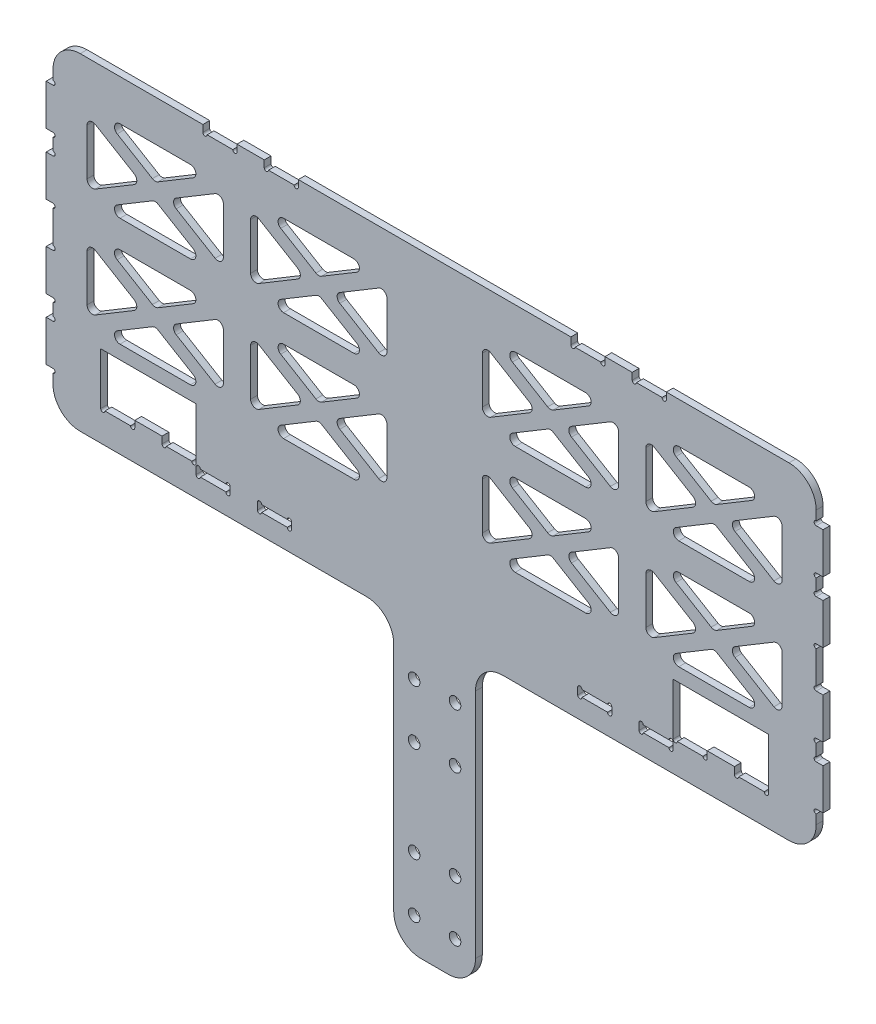
from build123d import *

# Parameters (mm, degrees)
EXTRUDE_1_DEPTH                = 5
SKETCH_2_R                     = 4.25
CUT_EXTRUDE_1_DEPTH            = 26
FILLET_1_R                     = 20
SKETCH_3_W                     = 5
SKETCH_3_H                     = 30
EXTRUDE_2_DEPTH                = 5
SKETCH_4_W                     = 70
SKETCH_4_H                     = 33
CUT_EXTRUDE_2_DEPTH            = 10
CUT_EXTRUDE_3_DEPTH            = 10
CUT_EXTRUDE_4_DEPTH            = 10
SKETCH_7_R                     = 1.55
CUT_EXTRUDE_5_DEPTH            = 5
CUT_EXTRUDE_6_DEPTH            = 5
FILLET_2_R                     = 4
PATTERN_LINEAR_1_COUNT         = 2
PATTERN_LINEAR_1_PITCH         = 120
PATTERN_LINEAR_1_COUNT_DIR2    = 2
PATTERN_LINEAR_1_PITCH_DIR2    = 80
FILLET_2_OF_PATTERN_LINEAR_1_R = 4
MIRROR_1_DEPTH                 = 5


# Read off the part's stored shape, not the designer's step: 镜向1
with BuildPart() as part:
    # 草图1 → 凸台-拉伸1 (new body)
    with BuildSketch(Plane.XY):
        Polygon((-30, 0), (30, 0), (30, 210), (280, 210), (280, 450), (-280, 450), (-280, 210), (-30, 210), align=None)
    extrude(amount=EXTRUDE_1_DEPTH)

    # 草图2 → 切除-拉伸1 (cut)
    with BuildSketch(Plane.XY.offset(5)):
        with Locations((15, 25)):
            Circle(SKETCH_2_R)
        with Locations((15, 65)):
            Circle(SKETCH_2_R)
        with Locations((15, 135)):
            Circle(SKETCH_2_R)
        with Locations((15, 175)):
            Circle(SKETCH_2_R)
        with Locations(Location((-15, 175, 0), (0, 0, 180))):
            Circle(SKETCH_2_R)
        with Locations(Location((-15, 135, 0), (0, 0, 180))):
            Circle(SKETCH_2_R)
        with Locations(Location((-15, 65, 0), (0, 0, 180))):
            Circle(SKETCH_2_R)
        with Locations(Location((-15, 25, 0), (0, 0, 180))):
            Circle(SKETCH_2_R)
    extrude(amount=-CUT_EXTRUDE_1_DEPTH, mode=Mode.SUBTRACT)

    # 圆角1
    fillet_1_edges = [part.edges().sort_by_distance(p)[0] for p in [
        (30, 0, 2.5),
        (-30, 0, 2.5),
        (-30, 210, 2.5),
        (-280, 210, 2.5),
        (-280, 450, 2.5),
        (280, 450, 2.5),
        (280, 210, 2.5),
        (30, 210, 2.5),
    ]]
    fillet(fillet_1_edges, radius=FILLET_1_R)

    # 草图3 → 凸台-拉伸2 (add)
    with BuildSketch(Plane.XY.offset(5)):
        with Locations((282.5, 255)):
            Rectangle(SKETCH_3_W, SKETCH_3_H)
        with Locations((282.5, 300)):
            Rectangle(SKETCH_3_W, SKETCH_3_H)
        with Locations((282.5, 405)):
            Rectangle(SKETCH_3_W, SKETCH_3_H)
        with Locations((282.5, 360)):
            Rectangle(SKETCH_3_W, SKETCH_3_H)
        with Locations((-282.5, 360)):
            Rectangle(SKETCH_3_W, SKETCH_3_H)
        with Locations((-282.5, 405)):
            Rectangle(SKETCH_3_W, SKETCH_3_H)
        with Locations((-282.5, 255)):
            Rectangle(SKETCH_3_W, SKETCH_3_H)
        with Locations((-282.5, 300)):
            Rectangle(SKETCH_3_W, SKETCH_3_H)
    extrude(amount=-EXTRUDE_2_DEPTH)

    # 草图4 → 切除-拉伸2 (cut)
    with BuildSketch(Plane.XY.offset(5)):
        with Locations((210, 253.5)):
            Rectangle(SKETCH_4_W, SKETCH_4_H)
        with Locations((-210, 253.5)):
            Rectangle(SKETCH_4_W, SKETCH_4_H)
    extrude(amount=-CUT_EXTRUDE_2_DEPTH, mode=Mode.SUBTRACT)

    # 草图5 → 切除-拉伸3 (cut)
    with BuildSketch(Plane.XY.offset(5)):
        with BuildLine():
            Line((-245, 237), (-220, 237))
            Line((-220, 237), (-220, 232))
            ThreePointArc((-220, 232), (-221.55, 230.45), (-223.1, 232))
            Line((-223.1, 232), (-241.9, 232))
            ThreePointArc((-241.9, 232), (-243.45, 230.45), (-245, 232))
            Line((-245, 232), (-245, 237))
        make_face()
        with BuildLine():
            Line((-200, 237), (-175, 237))
            Line((-175, 237), (-175, 232))
            ThreePointArc((-175, 232), (-176.55, 230.45), (-178.1, 232))
            Line((-178.1, 232), (-196.9, 232))
            ThreePointArc((-196.9, 232), (-198.45, 230.45), (-200, 232))
            Line((-200, 232), (-200, 237))
        make_face()
        with BuildLine():
            Line((175, 237), (175, 232))
            ThreePointArc((175, 232), (176.55, 230.45), (178.1, 232))
            Line((178.1, 232), (196.9, 232))
            ThreePointArc((196.9, 232), (198.45, 230.45), (200, 232))
            Line((200, 232), (200, 237))
            Line((200, 237), (175, 237))
        make_face()
        with BuildLine():
            Line((220, 237), (220, 232))
            ThreePointArc((220, 232), (221.55, 230.45), (223.1, 232))
            Line((223.1, 232), (241.9, 232))
            ThreePointArc((241.9, 232), (243.45, 230.45), (245, 232))
            Line((245, 232), (245, 237))
            Line((245, 237), (220, 237))
        make_face()
    extrude(amount=-CUT_EXTRUDE_3_DEPTH, mode=Mode.SUBTRACT)

    # 草图6 → 切除-拉伸4 (cut)
    with BuildSketch(Plane.XY.offset(5)):
        with BuildLine():
            Line((153.1, 230), (171.9, 230))
            ThreePointArc((171.9, 230), (173.45, 231.55), (175, 230))
            Line((175, 230), (175, 225))
            ThreePointArc((175, 225), (173.45, 223.45), (171.9, 225))
            Line((171.9, 225), (153.1, 225))
            ThreePointArc((153.1, 225), (151.55, 223.45), (150, 225))
            Line((150, 225), (150, 230))
            ThreePointArc((150, 230), (151.55, 231.55), (153.1, 230))
        make_face()
        with BuildLine():
            Line((108.1, 230), (126.9, 230))
            ThreePointArc((126.9, 230), (128.45, 231.55), (130, 230))
            Line((130, 230), (130, 225))
            ThreePointArc((130, 225), (128.45, 223.45), (126.9, 225))
            Line((126.9, 225), (108.1, 225))
            ThreePointArc((108.1, 225), (106.55, 223.45), (105, 225))
            Line((105, 225), (105, 230))
            ThreePointArc((105, 230), (106.55, 231.55), (108.1, 230))
        make_face()
        with BuildLine():
            Line((-130, 230), (-130, 225))
            ThreePointArc((-130, 225), (-128.45, 223.45), (-126.9, 225))
            Line((-126.9, 225), (-108.1, 225))
            ThreePointArc((-108.1, 225), (-106.55, 223.45), (-105, 225))
            Line((-105, 225), (-105, 230))
            ThreePointArc((-105, 230), (-106.55, 231.55), (-108.1, 230))
            Line((-108.1, 230), (-126.9, 230))
            ThreePointArc((-126.9, 230), (-128.45, 231.55), (-130, 230))
        make_face()
        with BuildLine():
            Line((-175, 230), (-175, 225))
            ThreePointArc((-175, 225), (-173.45, 223.45), (-171.9, 225))
            Line((-171.9, 225), (-153.1, 225))
            ThreePointArc((-153.1, 225), (-151.55, 223.45), (-150, 225))
            Line((-150, 225), (-150, 230))
            ThreePointArc((-150, 230), (-151.55, 231.55), (-153.1, 230))
            Line((-153.1, 230), (-171.9, 230))
            ThreePointArc((-171.9, 230), (-173.45, 231.55), (-175, 230))
        make_face()
    extrude(amount=-CUT_EXTRUDE_4_DEPTH, mode=Mode.SUBTRACT)

    # 草图7 → 切除-拉伸5 (cut)
    with BuildSketch(Plane.XY.offset(5)):
        with Locations((280, 421.55)):
            Circle(SKETCH_7_R)
        with Locations((280, 388.45)):
            Circle(SKETCH_7_R)
        with Locations((280, 376.55)):
            Circle(SKETCH_7_R)
        with Locations((280, 343.45)):
            Circle(SKETCH_7_R)
        with Locations((280, 316.55)):
            Circle(SKETCH_7_R)
        with Locations((280, 283.45)):
            Circle(SKETCH_7_R)
        with Locations((280, 271.55)):
            Circle(SKETCH_7_R)
        with Locations((280, 238.45)):
            Circle(SKETCH_7_R)
        with Locations((-280, 238.45)):
            Circle(SKETCH_7_R)
        with Locations((-280, 271.55)):
            Circle(SKETCH_7_R)
        with Locations((-280, 283.45)):
            Circle(SKETCH_7_R)
        with Locations((-280, 316.55)):
            Circle(SKETCH_7_R)
        with Locations((-280, 343.45)):
            Circle(SKETCH_7_R)
        with Locations((-280, 376.55)):
            Circle(SKETCH_7_R)
        with Locations((-280, 388.45)):
            Circle(SKETCH_7_R)
        with Locations((-280, 421.55)):
            Circle(SKETCH_7_R)
        with BuildLine():
            Line((100, 450), (125, 450))
            Line((125, 450), (125, 445))
            ThreePointArc((125, 445), (123.45, 443.45), (121.9, 445))
            Line((121.9, 445), (103.1, 445))
            ThreePointArc((103.1, 445), (101.55, 443.45), (100, 445))
            Line((100, 445), (100, 450))
        make_face()
        with BuildLine():
            Line((145, 450), (170, 450))
            Line((170, 450), (170, 445))
            ThreePointArc((170, 445), (168.45, 443.45), (166.9, 445))
            Line((166.9, 445), (148.1, 445))
            ThreePointArc((148.1, 445), (146.55, 443.45), (145, 445))
            Line((145, 445), (145, 450))
        make_face()
        with BuildLine():
            Line((-170, 450), (-170, 445))
            ThreePointArc((-170, 445), (-168.45, 443.45), (-166.9, 445))
            Line((-166.9, 445), (-148.1, 445))
            ThreePointArc((-148.1, 445), (-146.55, 443.45), (-145, 445))
            Line((-145, 445), (-145, 450))
            Line((-145, 450), (-170, 450))
        make_face()
        with BuildLine():
            Line((-125, 450), (-125, 445))
            ThreePointArc((-125, 445), (-123.45, 443.45), (-121.9, 445))
            Line((-121.9, 445), (-103.1, 445))
            ThreePointArc((-103.1, 445), (-101.55, 443.45), (-100, 445))
            Line((-100, 445), (-100, 450))
            Line((-100, 450), (-125, 450))
        make_face()
    extrude(amount=-CUT_EXTRUDE_5_DEPTH, mode=Mode.SUBTRACT)

    # 草图8 → 切除-拉伸6 (cut)
    with BuildSketch(Plane(origin=(0, 0, 0), x_dir=(-1, 0, 0), z_dir=(0, 0, -1))):
        Polygon((-245.281746842, 420), (-164.718253158, 420), (-205, 395.830951895), align=None)
        Polygon((-255, 414.169048105), (-255, 365.830951895), (-214.718253158, 390), align=None)
        Polygon((-245.281746842, 360), (-164.718253158, 360), (-205, 384.169048105), align=None)
        Polygon((-155, 414.169048105), (-155, 365.830951895), (-195.281746842, 390), align=None)
    cut_extrude_6 = extrude(amount=-CUT_EXTRUDE_6_DEPTH, mode=Mode.SUBTRACT)

    # 圆角2
    fillet_2_edges = [part.edges().sort_by_distance(p)[0] for p in [
        (255, 414.169048105, 2.5),
        (214.718253158, 390, 2.5),
        (255, 365.830951895, 2.5),
        (195.281746842, 390, 2.5),
        (155, 414.169048105, 2.5),
        (155, 365.830951895, 2.5),
        (205, 384.169048105, 2.5),
        (164.718253158, 360, 2.5),
        (245.281746842, 360, 2.5),
        (205, 395.830951895, 2.5),
        (245.281746842, 420, 2.5),
        (164.718253158, 420, 2.5),
    ]]
    fillet(fillet_2_edges, radius=FILLET_2_R)

    # 阵列(线性)1: Cut-Extrude 6 2 × 2
    with Locations(*[(-i * PATTERN_LINEAR_1_PITCH, -j * PATTERN_LINEAR_1_PITCH_DIR2, 0) for i in range(PATTERN_LINEAR_1_COUNT) for j in range(PATTERN_LINEAR_1_COUNT_DIR2) if (i, j) != (0, 0)]):
        add(cut_extrude_6, mode=Mode.SUBTRACT)

    # 圆角2 of 阵列(线性)1
    fillet_2_of_pattern_linear_1_edges = [part.edges().sort_by_distance(p)[0] for p in [
        (255, 334.169048105, 2.5),
        (214.718253158, 310, 2.5),
        (255, 285.830951895, 2.5),
        (195.281746842, 310, 2.5),
        (155, 334.169048105, 2.5),
        (155, 285.830951895, 2.5),
        (205, 304.169048105, 2.5),
        (164.718253158, 280, 2.5),
        (245.281746842, 280, 2.5),
        (205, 315.830951895, 2.5),
        (245.281746842, 340, 2.5),
        (164.718253158, 340, 2.5),
        (135, 414.169048105, 2.5),
        (94.718253158, 390, 2.5),
        (135, 365.830951895, 2.5),
        (75.281746842, 390, 2.5),
        (35, 414.169048105, 2.5),
        (35, 365.830951895, 2.5),
        (85, 384.169048105, 2.5),
        (44.718253158, 360, 2.5),
        (125.281746842, 360, 2.5),
        (85, 395.830951895, 2.5),
        (125.281746842, 420, 2.5),
        (44.718253158, 420, 2.5),
        (135, 334.169048105, 2.5),
        (94.718253158, 310, 2.5),
        (135, 285.830951895, 2.5),
        (75.281746842, 310, 2.5),
        (35, 334.169048105, 2.5),
        (35, 285.830951895, 2.5),
        (85, 304.169048105, 2.5),
        (44.718253158, 280, 2.5),
        (125.281746842, 280, 2.5),
        (85, 315.830951895, 2.5),
        (125.281746842, 340, 2.5),
        (44.718253158, 340, 2.5),
    ]]
    fillet(fillet_2_of_pattern_linear_1_edges, radius=FILLET_2_OF_PATTERN_LINEAR_1_R)

    # 镜向1 outline → 镜向1 (cut)
    with BuildSketch(Plane.XY):
        with BuildLine():
            Line((-110.840477649, 280), (-59.159522351, 280))
            ThreePointArc((-59.159522351, 280), (-55.304662638, 282.932265672), (-57.101539329, 287.429971703))
            Line((-57.101539329, 287.429971703), (-82.942016978, 302.934258292))
            ThreePointArc((-82.942016978, 302.934258292), (-85, 303.504286589), (-87.057983022, 302.934258292))
            Line((-87.057983022, 302.934258292), (-112.898460671, 287.429971703))
            ThreePointArc((-112.898460671, 287.429971703), (-114.695337362, 282.932265672), (-110.840477649, 280))
        make_face()
        with BuildLine():
            Line((-230.840477649, 280), (-179.159522351, 280))
            ThreePointArc((-179.159522351, 280), (-175.304662638, 282.932265672), (-177.101539329, 287.429971703))
            Line((-177.101539329, 287.429971703), (-202.942016978, 302.934258292))
            ThreePointArc((-202.942016978, 302.934258292), (-205, 303.504286589), (-207.057983022, 302.934258292))
            Line((-207.057983022, 302.934258292), (-232.898460671, 287.429971703))
            ThreePointArc((-232.898460671, 287.429971703), (-234.695337362, 282.932265672), (-230.840477649, 280))
        make_face()
        with BuildLine():
            Line((-59.159522351, 340), (-110.840477649, 340))
            ThreePointArc((-110.840477649, 340), (-114.695337362, 337.067734328), (-112.898460671, 332.570028297))
            Line((-112.898460671, 332.570028297), (-87.057983022, 317.065741708))
            ThreePointArc((-87.057983022, 317.065741708), (-85, 316.495713411), (-82.942016978, 317.065741708))
            Line((-82.942016978, 317.065741708), (-57.101539329, 332.570028297))
            ThreePointArc((-57.101539329, 332.570028297), (-55.304662638, 337.067734328), (-59.159522351, 340))
        make_face()
        with BuildLine():
            Line((-179.159522351, 340), (-230.840477649, 340))
            ThreePointArc((-230.840477649, 340), (-234.695337362, 337.067734328), (-232.898460671, 332.570028297))
            Line((-232.898460671, 332.570028297), (-207.057983022, 317.065741708))
            ThreePointArc((-207.057983022, 317.065741708), (-205, 316.495713411), (-202.942016978, 317.065741708))
            Line((-202.942016978, 317.065741708), (-177.101539329, 332.570028297))
            ThreePointArc((-177.101539329, 332.570028297), (-175.304662638, 337.067734328), (-179.159522351, 340))
        make_face()
        with BuildLine():
            Line((-179.159522351, 420), (-230.840477649, 420))
            ThreePointArc((-230.840477649, 420), (-234.695337362, 417.067734328), (-232.898460671, 412.570028297))
            Line((-232.898460671, 412.570028297), (-207.057983022, 397.065741708))
            ThreePointArc((-207.057983022, 397.065741708), (-205, 396.495713411), (-202.942016978, 397.065741708))
            Line((-202.942016978, 397.065741708), (-177.101539329, 412.570028297))
            ThreePointArc((-177.101539329, 412.570028297), (-175.304662638, 417.067734328), (-179.159522351, 420))
        make_face()
        with BuildLine():
            Line((-59.159522351, 420), (-110.840477649, 420))
            ThreePointArc((-110.840477649, 420), (-114.695337362, 417.067734328), (-112.898460671, 412.570028297))
            Line((-112.898460671, 412.570028297), (-87.057983022, 397.065741708))
            ThreePointArc((-87.057983022, 397.065741708), (-85, 396.495713411), (-82.942016978, 397.065741708))
            Line((-82.942016978, 397.065741708), (-57.101539329, 412.570028297))
            ThreePointArc((-57.101539329, 412.570028297), (-55.304662638, 417.067734328), (-59.159522351, 420))
        make_face()
        with BuildLine():
            Line((-110.840477649, 360), (-59.159522351, 360))
            ThreePointArc((-59.159522351, 360), (-55.304662638, 362.932265672), (-57.101539329, 367.429971703))
            Line((-57.101539329, 367.429971703), (-82.942016978, 382.934258292))
            ThreePointArc((-82.942016978, 382.934258292), (-85, 383.504286589), (-87.057983022, 382.934258292))
            Line((-87.057983022, 382.934258292), (-112.898460671, 367.429971703))
            ThreePointArc((-112.898460671, 367.429971703), (-114.695337362, 362.932265672), (-110.840477649, 360))
        make_face()
        with BuildLine():
            Line((-230.840477649, 360), (-179.159522351, 360))
            ThreePointArc((-179.159522351, 360), (-175.304662638, 362.932265672), (-177.101539329, 367.429971703))
            Line((-177.101539329, 367.429971703), (-202.942016978, 382.934258292))
            ThreePointArc((-202.942016978, 382.934258292), (-205, 383.504286589), (-207.057983022, 382.934258292))
            Line((-207.057983022, 382.934258292), (-232.898460671, 367.429971703))
            ThreePointArc((-232.898460671, 367.429971703), (-234.695337362, 362.932265672), (-230.840477649, 360))
        make_face()
        with BuildLine():
            Line((-248.942016978, 369.465741708), (-220.434872663, 386.570028297))
            ThreePointArc((-220.434872663, 386.570028297), (-218.492855685, 390), (-220.434872663, 393.429971703))
            Line((-220.434872663, 393.429971703), (-248.942016978, 410.534258292))
            ThreePointArc((-248.942016978, 410.534258292), (-252.97079526, 410.585086216), (-255, 407.104286589))
            Line((-255, 407.104286589), (-255, 372.895713411))
            ThreePointArc((-255, 372.895713411), (-252.97079526, 369.414913784), (-248.942016978, 369.465741708))
        make_face()
        with BuildLine():
            Line((-189.565127337, 386.570028297), (-161.057983022, 369.465741708))
            ThreePointArc((-161.057983022, 369.465741708), (-157.02920474, 369.414913784), (-155, 372.895713411))
            Line((-155, 372.895713411), (-155, 407.104286589))
            ThreePointArc((-155, 407.104286589), (-157.02920474, 410.585086216), (-161.057983022, 410.534258292))
            Line((-161.057983022, 410.534258292), (-189.565127337, 393.429971703))
            ThreePointArc((-189.565127337, 393.429971703), (-191.507144315, 390), (-189.565127337, 386.570028297))
        make_face()
        with BuildLine():
            Line((-128.942016978, 289.465741708), (-100.434872663, 306.570028297))
            ThreePointArc((-100.434872663, 306.570028297), (-98.492855685, 310), (-100.434872663, 313.429971703))
            Line((-100.434872663, 313.429971703), (-128.942016978, 330.534258292))
            ThreePointArc((-128.942016978, 330.534258292), (-132.97079526, 330.585086216), (-135, 327.104286589))
            Line((-135, 327.104286589), (-135, 292.895713411))
            ThreePointArc((-135, 292.895713411), (-132.97079526, 289.414913784), (-128.942016978, 289.465741708))
        make_face()
        with BuildLine():
            Line((-69.565127337, 306.570028297), (-41.057983022, 289.465741708))
            ThreePointArc((-41.057983022, 289.465741708), (-37.02920474, 289.414913784), (-35, 292.895713411))
            Line((-35, 292.895713411), (-35, 327.104286589))
            ThreePointArc((-35, 327.104286589), (-37.02920474, 330.585086216), (-41.057983022, 330.534258292))
            Line((-41.057983022, 330.534258292), (-69.565127337, 313.429971703))
            ThreePointArc((-69.565127337, 313.429971703), (-71.507144315, 310), (-69.565127337, 306.570028297))
        make_face()
        with BuildLine():
            Line((-41.057983022, 410.534258292), (-69.565127337, 393.429971703))
            ThreePointArc((-69.565127337, 393.429971703), (-71.507144315, 390), (-69.565127337, 386.570028297))
            Line((-69.565127337, 386.570028297), (-41.057983022, 369.465741708))
            ThreePointArc((-41.057983022, 369.465741708), (-37.02920474, 369.414913784), (-35, 372.895713411))
            Line((-35, 372.895713411), (-35, 407.104286589))
            ThreePointArc((-35, 407.104286589), (-37.02920474, 410.585086216), (-41.057983022, 410.534258292))
        make_face()
        with BuildLine():
            Line((-100.434872663, 393.429971703), (-128.942016978, 410.534258292))
            ThreePointArc((-128.942016978, 410.534258292), (-132.97079526, 410.585086216), (-135, 407.104286589))
            Line((-135, 407.104286589), (-135, 372.895713411))
            ThreePointArc((-135, 372.895713411), (-132.97079526, 369.414913784), (-128.942016978, 369.465741708))
            Line((-128.942016978, 369.465741708), (-100.434872663, 386.570028297))
            ThreePointArc((-100.434872663, 386.570028297), (-98.492855685, 390), (-100.434872663, 393.429971703))
        make_face()
        with BuildLine():
            Line((-248.942016978, 289.465741708), (-220.434872663, 306.570028297))
            ThreePointArc((-220.434872663, 306.570028297), (-218.492855685, 310), (-220.434872663, 313.429971703))
            Line((-220.434872663, 313.429971703), (-248.942016978, 330.534258292))
            ThreePointArc((-248.942016978, 330.534258292), (-252.97079526, 330.585086216), (-255, 327.104286589))
            Line((-255, 327.104286589), (-255, 292.895713411))
            ThreePointArc((-255, 292.895713411), (-252.97079526, 289.414913784), (-248.942016978, 289.465741708))
        make_face()
        with BuildLine():
            Line((-189.565127337, 306.570028297), (-161.057983022, 289.465741708))
            ThreePointArc((-161.057983022, 289.465741708), (-157.02920474, 289.414913784), (-155, 292.895713411))
            Line((-155, 292.895713411), (-155, 327.104286589))
            ThreePointArc((-155, 327.104286589), (-157.02920474, 330.585086216), (-161.057983022, 330.534258292))
            Line((-161.057983022, 330.534258292), (-189.565127337, 313.429971703))
            ThreePointArc((-189.565127337, 313.429971703), (-191.507144315, 310), (-189.565127337, 306.570028297))
        make_face()
    extrude(amount=MIRROR_1_DEPTH, mode=Mode.SUBTRACT)


solid = part.part
